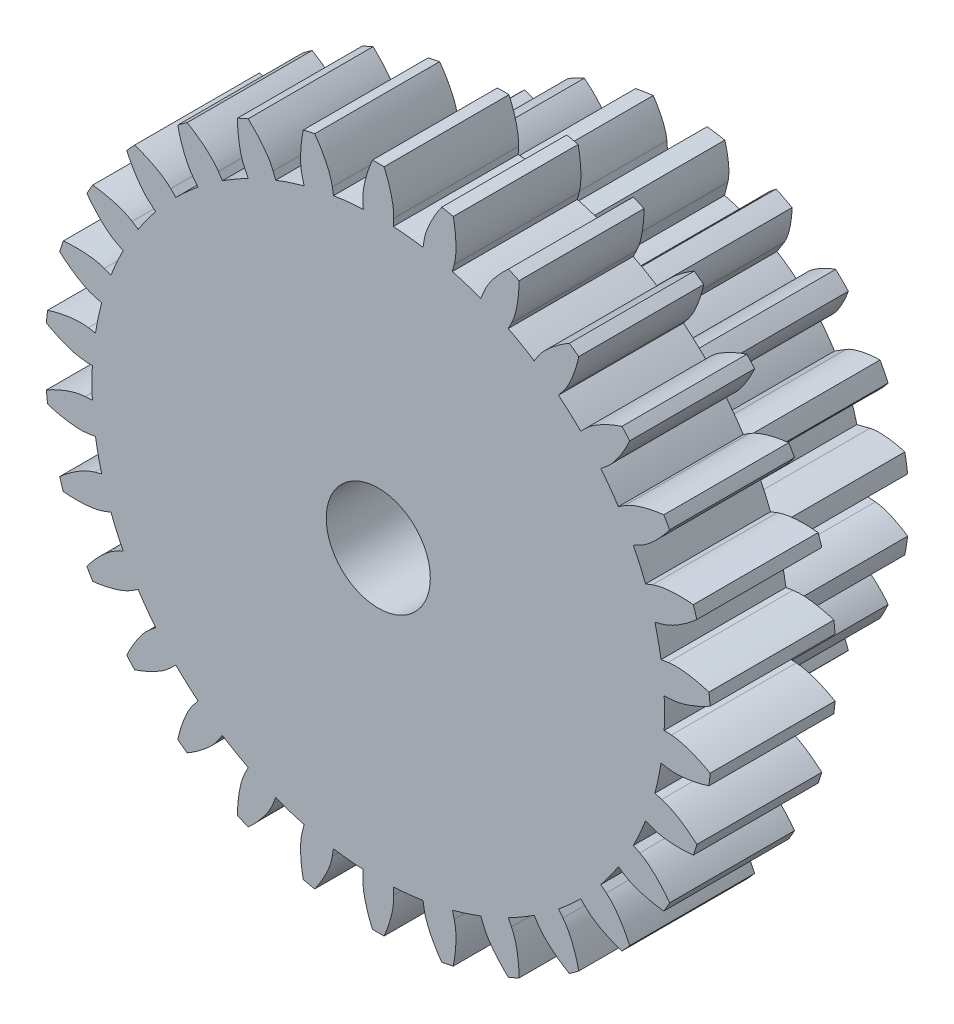
from build123d import *

# Parameters (mm, degrees)
SKETCH_1_R               = 2.2
SKETCH_1_R_2             = 0.5
EXTRUDE_1_DEPTH          = 1.7
CUT_EXTRUDE_1_DEPTH      = 4.54541958
PATTERN_CIRCULAR_1_COUNT = 20
PATTERN_CIRCULAR_1_ANGLE = 342
SKETCH_2_R               = 3.2
SKETCH_2_R_2             = 0.5
EXTRUDE_2_DEPTH          = 1.2
CUT_EXTRUDE_3_DEPTH      = 5.834252954
PATTERN_CIRCULAR_2_COUNT = 30


with BuildPart() as part:
    # 草图1 → 凸台-拉伸1 (new body)
    with BuildSketch(Plane.XY):
        Circle(SKETCH_1_R)
        Circle(SKETCH_1_R_2, mode=Mode.SUBTRACT)
    extrude(amount=EXTRUDE_1_DEPTH)

    # 草图1<3> → 切除-拉伸1 (cut, through all)
    with BuildSketch(Plane.XY):
        with BuildLine():
            Line((1.875038496, 0.127747889), (1.745952504, 0.118953156))
            ThreePointArc((1.745952504, 0.118953156), (1.748987833, 0.059510998), (1.75, 0))
            ThreePointArc((1.75, 0), (1.748987833, -0.059510998), (1.745952504, -0.118953156))
            Line((1.745952504, -0.118953156), (1.875038496, -0.127747889))
            add(Edge.make_bspline(
                [(1.875038496, -0.127747889), (1.889331408, -0.128721676), (1.929015864, -0.134409782), (2.002495743, -0.157024988), (2.079657128, -0.192996565), (2.140439093, -0.229140118), (2.177678908, -0.254137881), (2.184706013, -0.258958755)],
                knots=[0, 0, 0, 0, 0, 0.005604068, 0.015718248, 0.029959916, 0.033300539, 0.033300539, 0.033300539, 0.033300539, 0.033300539], degree=4))
            ThreePointArc((2.184706013, -0.258958755), (2.196173175, -0.129704995), (2.2, 0))
            ThreePointArc((2.2, 0), (2.196173175, 0.129704995), (2.184706013, 0.258958755))
            add(Edge.make_bspline(
                [(1.875038496, 0.127747889), (1.889331408, 0.128721676), (1.929015864, 0.134409782), (2.002495743, 0.157024988), (2.079657128, 0.192996565), (2.140439093, 0.229140118), (2.177678908, 0.254137881), (2.184706013, 0.258958755)],
                knots=[0, 0, 0, 0, 0, 0.005604068, 0.015718248, 0.029959916, 0.033300539, 0.033300539, 0.033300539, 0.033300539, 0.033300539], degree=4))
        make_face()
    cut_extrude_1 = extrude(amount=CUT_EXTRUDE_1_DEPTH, mode=Mode.SUBTRACT)

    # 阵列(圆周)1: 切除-拉伸1 ×20 about axis
    pattern_circular_1_axis = Axis((0, 0, 1.7), (0, 0, 1))
    for i in range(1, PATTERN_CIRCULAR_1_COUNT):
        add(cut_extrude_1.rotate(pattern_circular_1_axis, i * PATTERN_CIRCULAR_1_ANGLE / (PATTERN_CIRCULAR_1_COUNT - 1)), mode=Mode.SUBTRACT)

    # 草图2 → 凸台-拉伸2 (add)
    with BuildSketch(Plane.XY.offset(1.7)):
        Circle(SKETCH_2_R)
        Circle(SKETCH_2_R_2, mode=Mode.SUBTRACT)
    extrude(amount=EXTRUDE_2_DEPTH)

    # 草图2<3> → 切除-拉伸3 (cut, through all)
    with BuildSketch(Plane.XY.offset(1.7)):
        with BuildLine():
            Line((2.815214414, 0.147539136), (2.746231221, 0.14392388))
            ThreePointArc((2.746231221, 0.14392388), (2.749057644, 0.071986608), (2.75, 0))
            ThreePointArc((2.75, 0), (2.749057644, -0.071986608), (2.746231221, -0.14392388))
            Line((2.746231221, -0.14392388), (2.815214414, -0.147539136))
            add(Edge.make_bspline(
                [(2.815214414, -0.147539136), (2.836674033, -0.148663787), (2.896326911, -0.156262405), (2.992499881, -0.18422024), (3.08425284, -0.223276966), (3.153552433, -0.259315751), (3.187838391, -0.278722786)],
                knots=[0, 0, 0, 0, 0, 0.005604068, 0.015718248, 0.026019312, 0.026019312, 0.026019312, 0.026019312, 0.026019312], degree=4))
            ThreePointArc((3.187838391, -0.278722786), (3.196958152, -0.139493993), (3.2, 0))
            ThreePointArc((3.2, 0), (3.196958152, 0.139493993), (3.187838391, 0.278722786))
            add(Edge.make_bspline(
                [(2.815214414, 0.147539136), (2.836674033, 0.148663787), (2.896326911, 0.156262405), (2.992499881, 0.18422024), (3.08425284, 0.223276966), (3.153552433, 0.259315751), (3.187838391, 0.278722786)],
                knots=[0, 0, 0, 0, 0, 0.005604068, 0.015718248, 0.026019312, 0.026019312, 0.026019312, 0.026019312, 0.026019312], degree=4))
        make_face()
    cut_extrude_3 = extrude(amount=CUT_EXTRUDE_3_DEPTH, mode=Mode.SUBTRACT)

    # 阵列(圆周)2: 切除-拉伸3 ×30 about axis
    pattern_circular_2_axis = Axis((0, 0, 2.9), (0, 0, 1))
    for i in range(1, PATTERN_CIRCULAR_2_COUNT):
        add(cut_extrude_3.rotate(pattern_circular_2_axis, i * 360 / PATTERN_CIRCULAR_2_COUNT), mode=Mode.SUBTRACT)


solid = part.part
